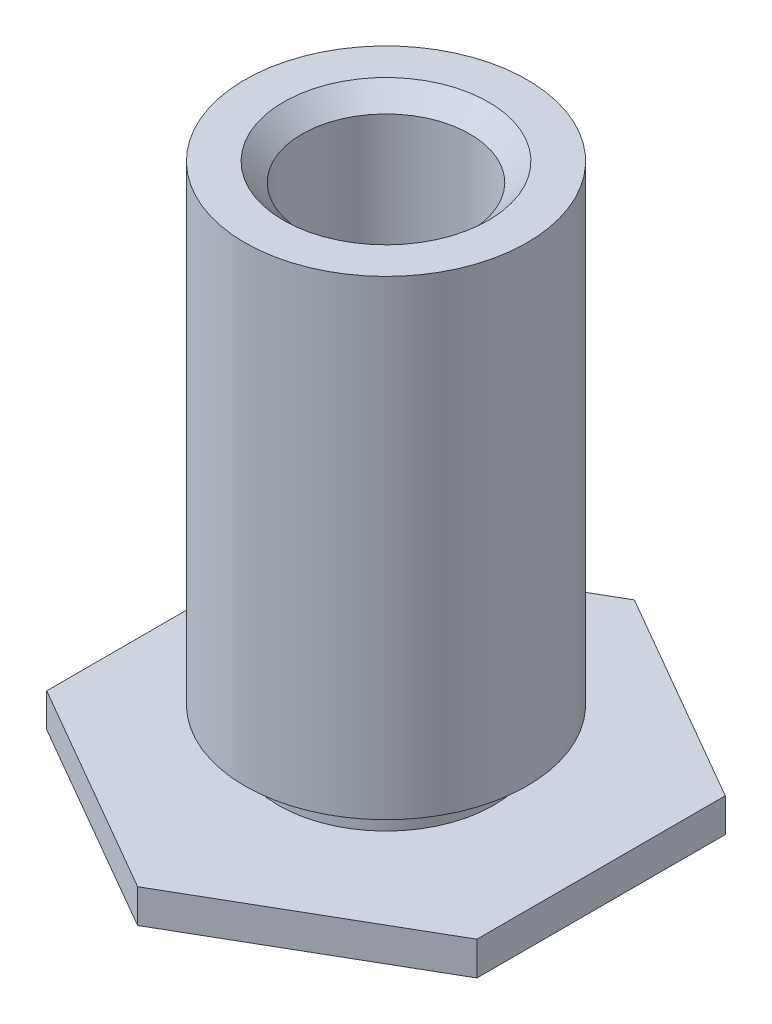
from build123d import *

# Parameters (mm, degrees)
RESSALTO_EXTRUS_O1_START            = -4.5
RESSALTO_EXTRUS_O1_OUTLINE_R        = 2.5
RESSALTO_EXTRUS_O1_DEPTH            = 4.5
RESSALTO_EXTRUS_O1_START_2          = -3.5
RESSALTO_EXTRUS_O1_2_OUTLINE_R      = 2.695
RESSALTO_EXTRUS_O1_2_OUTLINE_R_2    = 2.5
RESSALTO_EXTRUS_O1_2_DEPTH          = 3.5
RESSALTO_EXTRUS_O1_3_OUTLINE_R      = 2.5
RESSALTO_EXTRUS_O1_3_DEPTH          = 0.5
ESBO_O2_R                           = 2.695
RESSALTO_EXTRUS_O2_DEPTH            = 3.5
FURO_ROSCADO_DE_M3X0_51_D           = 2.5
FURO_ROSCADO_DE_M3X0_51_CSINK_D     = 3.05
FURO_ROSCADO_DE_M3X0_51_CSINK_ANGLE = 90
CORTE_EXTRUS_O1_START               = -7.5
ESBO_O7_R                           = 2.695
ESBO_O7_R_2                         = 2.1
CORTE_EXTRUS_O1_DEPTH               = 7.5
ESBO_O8_R                           = 2.1
ESBO_O8_R_2                         = 1.6
CORTE_EXTRUS_O2_DEPTH               = 0.5


with BuildPart() as part:
    # Ressalto-extrusão1: read off the stored shape, not the designer's step
    # Ressalto-extrusão1 outline → Ressalto-extrusão1 (new body)
    with BuildSketch(Plane(origin=(0, 4.5, 0), x_dir=(1, 0, 0), z_dir=(0, 1, 0)).offset(RESSALTO_EXTRUS_O1_START)):
        Circle(RESSALTO_EXTRUS_O1_OUTLINE_R)
    extrude(amount=RESSALTO_EXTRUS_O1_DEPTH)

    # Ressalto-extrus_o1 2 outline → Ressalto-extrus_o1 2 (add)
    with BuildSketch(Plane(origin=(0, 4.5, 0), x_dir=(1, 0, 0), z_dir=(0, 1, 0)).offset(RESSALTO_EXTRUS_O1_START_2)):
        Circle(RESSALTO_EXTRUS_O1_2_OUTLINE_R)
        Circle(RESSALTO_EXTRUS_O1_2_OUTLINE_R_2, mode=Mode.SUBTRACT)
    extrude(amount=RESSALTO_EXTRUS_O1_2_DEPTH)

    # Ressalto-extrus_o1 3 outline → Ressalto-extrus_o1 3 (add)
    with BuildSketch(Plane(origin=(0, 4.5, 0), x_dir=(1, 0, 0), z_dir=(0, 1, 0)).offset(RESSALTO_EXTRUS_O1_START)):
        Polygon((0, 3.695041723), (-3.2, 1.847520861), (-3.2, -1.847520861), (0, -3.695041723), (3.2, -1.847520861), (3.2, 1.847520861), align=None)
        Circle(RESSALTO_EXTRUS_O1_3_OUTLINE_R, mode=Mode.SUBTRACT)
    extrude(amount=RESSALTO_EXTRUS_O1_3_DEPTH)

    # Esboço2 → Ressalto-extrusão2 (add)
    with BuildSketch(Plane(origin=(0, 4.5, 0), x_dir=(1, 0, 0), z_dir=(0, 1, 0))):
        with Locations(Location((0, 0, 0), (0, 0, 90))):
            Circle(ESBO_O2_R)
    extrude(amount=RESSALTO_EXTRUS_O2_DEPTH)

    # Furo roscado de M3x0.51 (through all)
    with Locations(Plane(origin=(0, 8, 0), x_dir=(1, 0, 0), z_dir=(0, 1, 0))):
        with Locations((0, 0)):
            CounterSinkHole(FURO_ROSCADO_DE_M3X0_51_D / 2, FURO_ROSCADO_DE_M3X0_51_CSINK_D / 2, counter_sink_angle=FURO_ROSCADO_DE_M3X0_51_CSINK_ANGLE)

    # Esboço7 → Corte-extrusão1 (cut)
    with BuildSketch(Plane(origin=(0, 8, 0), x_dir=(1, 0, 0), z_dir=(0, 1, 0)).offset(CORTE_EXTRUS_O1_START)):
        Circle(ESBO_O7_R)
        with Locations(Location((0, 0, 0), (0, 0, 270))):
            Circle(ESBO_O7_R_2, mode=Mode.SUBTRACT)
    extrude(amount=CORTE_EXTRUS_O1_DEPTH, mode=Mode.SUBTRACT)

    # Esboço8 → Corte-extrusão2 (cut)
    with BuildSketch(Plane(origin=(0, 0.5, 0), x_dir=(1, 0, 0), z_dir=(0, 1, 0))):
        with Locations(Location((0, 0, 0), (0, 0, 270))):
            Circle(ESBO_O8_R)
        with Locations(Location((0, 0, 0), (0, 0, 270))):
            Circle(ESBO_O8_R_2, mode=Mode.SUBTRACT)
    extrude(amount=CORTE_EXTRUS_O2_DEPTH, mode=Mode.SUBTRACT)


solid = part.part
